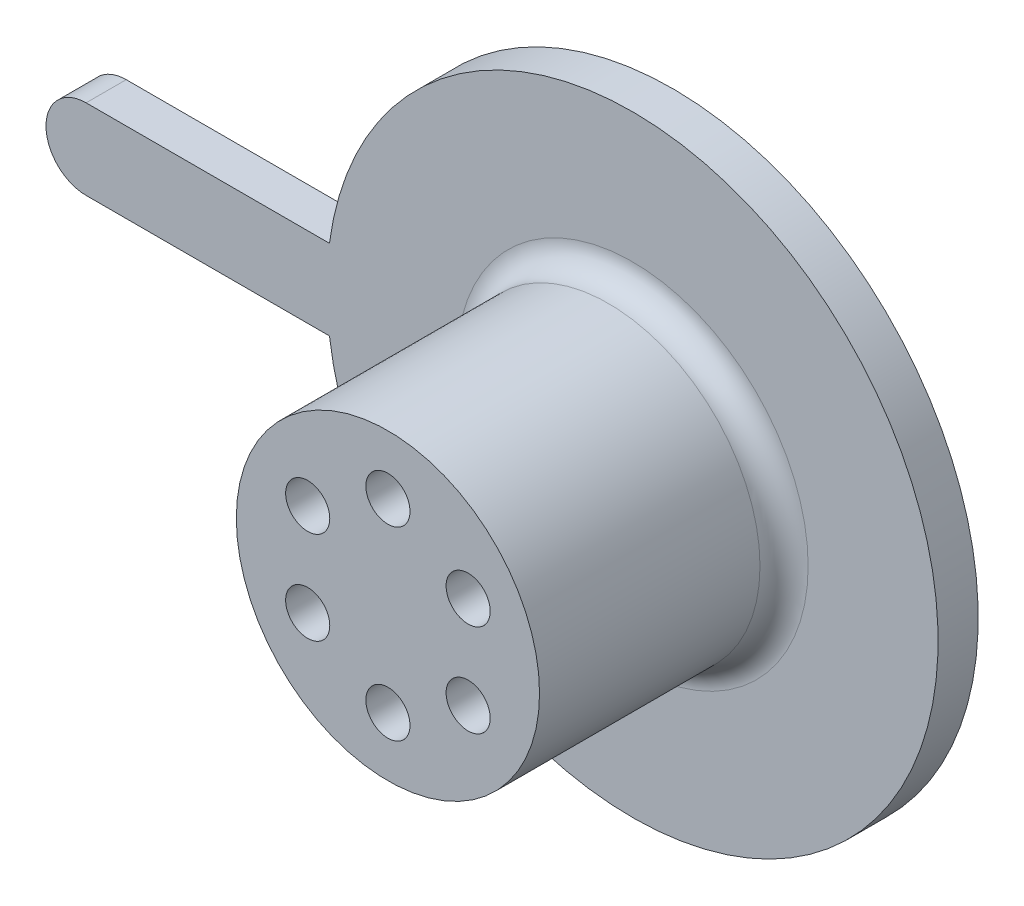
from build123d import *

# Parameters (mm, degrees)
BOSS_EXTRUDE3_DEPTH = 5
SKETCH5_R           = 18.9
BOSS_EXTRUDE4_DEPTH = 30.48
FILLET4_R           = 3
SKETCH6_R           = 2.75
CUT_EXTRUDE4_DEPTH  = 39.48


with BuildPart() as part:
    # Sketch4 → Boss-Extrude3 (new body)
    with BuildSketch(Plane.XY):
        with BuildLine():
            Line((-68.1, -5), (-37.770491127, -5))
            ThreePointArc((-37.770491127, -5), (38.1, 0), (-37.770491127, 5))
            Line((-37.770491127, 5), (-68.1, 5))
            ThreePointArc((-68.1, 5), (-73.1, 0), (-68.1, -5))
        make_face()
    extrude(amount=BOSS_EXTRUDE3_DEPTH)

    # Sketch5 → Boss-Extrude4 (add)
    with BuildSketch(Plane.XY.offset(5)):
        Circle(SKETCH5_R)
    extrude(amount=BOSS_EXTRUDE4_DEPTH)

    # Fillet4
    fillet4_edges = [part.edges().sort_by_distance(p)[0] for p in [
        (-18.9, 0, 5),
    ]]
    fillet(fillet4_edges, radius=FILLET4_R)

    # Sketch6 → Cut-Extrude4 (cut)
    with BuildSketch(Plane.XY.offset(35.48)):
        with Locations((0, 11.547005384)):
            Circle(SKETCH6_R)
        with Locations((-10, 5.773502692)):
            Circle(SKETCH6_R)
        with Locations((10, 5.773502692)):
            Circle(SKETCH6_R)
        with Locations((-10, -5.773502692)):
            Circle(SKETCH6_R)
        with Locations((10, -5.773502692)):
            Circle(SKETCH6_R)
        with Locations((0, -11.547005384)):
            Circle(SKETCH6_R)
    extrude(amount=-CUT_EXTRUDE4_DEPTH, mode=Mode.SUBTRACT)


solid = part.part
